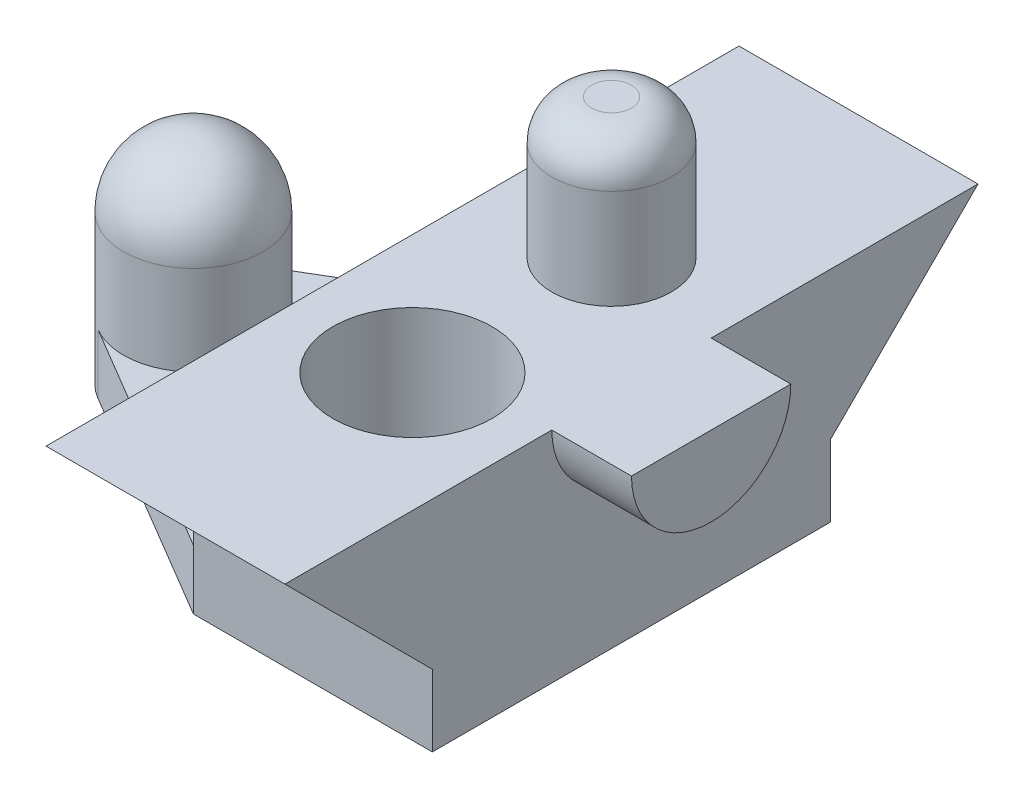
from build123d import *
from build123d.topology import SkipClean

# Parameters (mm, degrees)
BOSS_EXTRUDE1_DEPTH = 1.5
BOSS_EXTRUDE2_START = 4
SKETCH2_R           = 1.75
SKETCH2_W           = 6
SKETCH2_H           = 10
BOSS_EXTRUDE2_DEPTH = 4
FILLET1_R           = 1.75
SKETCH4_R           = 1.5
BOSS_EXTRUDE4_DEPTH = 3.5
FILLET2_R           = 1
SKETCH5_R           = 2
CUT_EXTRUDE1_DEPTH  = 3.75
BOSS_EXTRUDE5_DEPTH = 2
BOSS_EXTRUDE6_DEPTH = 6


with BuildPart() as part:
    # Sketch1 → Boss-Extrude1 (new body)
    with BuildSketch(Plane(origin=(0, 0, 0), x_dir=(1, 0, 0), z_dir=(0, 1, 0))):
        with BuildLine():
            Line((5, 5), (11, 5))
            Line((11, 5), (11, -5))
            Line((11, -5), (5, -5))
            Line((5, -5), (-0.892692, -1.505192))
            ThreePointArc((-0.892692, -1.505192), (-1.75, 0), (-0.892692, 1.505192))
            Line((-0.892692, 1.505192), (5, 5))
        make_face()
    extrude(amount=-BOSS_EXTRUDE1_DEPTH)

    # Sketch2 → Boss-Extrude2 (add)
    with SkipClean():  # the faces are left unmerged after this step: merging them gives an invalid solid
        with BuildSketch(Plane(origin=(0, 0, 0), x_dir=(1, 0, 0), z_dir=(0, 1, 0)).offset(BOSS_EXTRUDE2_START)):
            Circle(SKETCH2_R)
            with Locations((8, 0)):
                Rectangle(SKETCH2_W, SKETCH2_H)
        extrude(amount=-BOSS_EXTRUDE2_DEPTH)

    # Fillet1
    fillet1_edges = [part.edges().sort_by_distance(p)[0] for p in [
        (-1.75, 4, 0),
    ]]
    fillet(fillet1_edges, radius=FILLET1_R)

    # Sketch4 → Boss-Extrude4 (add)
    with SkipClean():  # the faces are left unmerged after this step: merging them gives an invalid solid
        with BuildSketch(Plane(origin=(0, 4, 0), x_dir=(1, 0, 0), z_dir=(0, 1, 0))):
            with Locations((8, 2.5)):
                Circle(SKETCH4_R)
        extrude(amount=BOSS_EXTRUDE4_DEPTH)

    # Fillet2
    fillet2_edges = [part.edges().sort_by_distance(p)[0] for p in [
        (6.5, 7.5, -2.5),
    ]]
    fillet(fillet2_edges, radius=FILLET2_R)

    # Sketch5 → Cut-Extrude1 (cut)
    with SkipClean():  # the faces are left unmerged after this step: merging them gives an invalid solid
        with BuildSketch(Plane(origin=(0, 4, 0), x_dir=(1, 0, 0), z_dir=(0, 1, 0))):
            with Locations((8, -2.5)):
                Circle(SKETCH5_R)
        extrude(amount=-CUT_EXTRUDE1_DEPTH, mode=Mode.SUBTRACT)

    # Sketch6 → Boss-Extrude5 (add)
    with SkipClean():  # the faces are left unmerged after this step: merging them gives an invalid solid
        with BuildSketch(Plane(origin=(11, 0, 0), x_dir=(0, 0, -1), z_dir=(1, 0, 0))):
            with BuildLine():
                Line((-2, 4), (2, 4))
                ThreePointArc((2, 4), (0, 2), (-2, 4))
            make_face()
        extrude(amount=BOSS_EXTRUDE5_DEPTH)

    # Sketch9 → Boss-Extrude6 (add)
    with SkipClean():  # the faces are left unmerged after this step: merging them gives an invalid solid
        with BuildSketch(Plane(origin=(11, 0, 0), x_dir=(0, 0, -1), z_dir=(1, 0, 0))):
            Polygon((-5, 4), (-8.7, 4), (-5, 0.3), align=None)
            Polygon((5, 0.3), (5, 4), (8.7, 4), align=None)
        extrude(amount=-BOSS_EXTRUDE6_DEPTH)


solid = part.part
